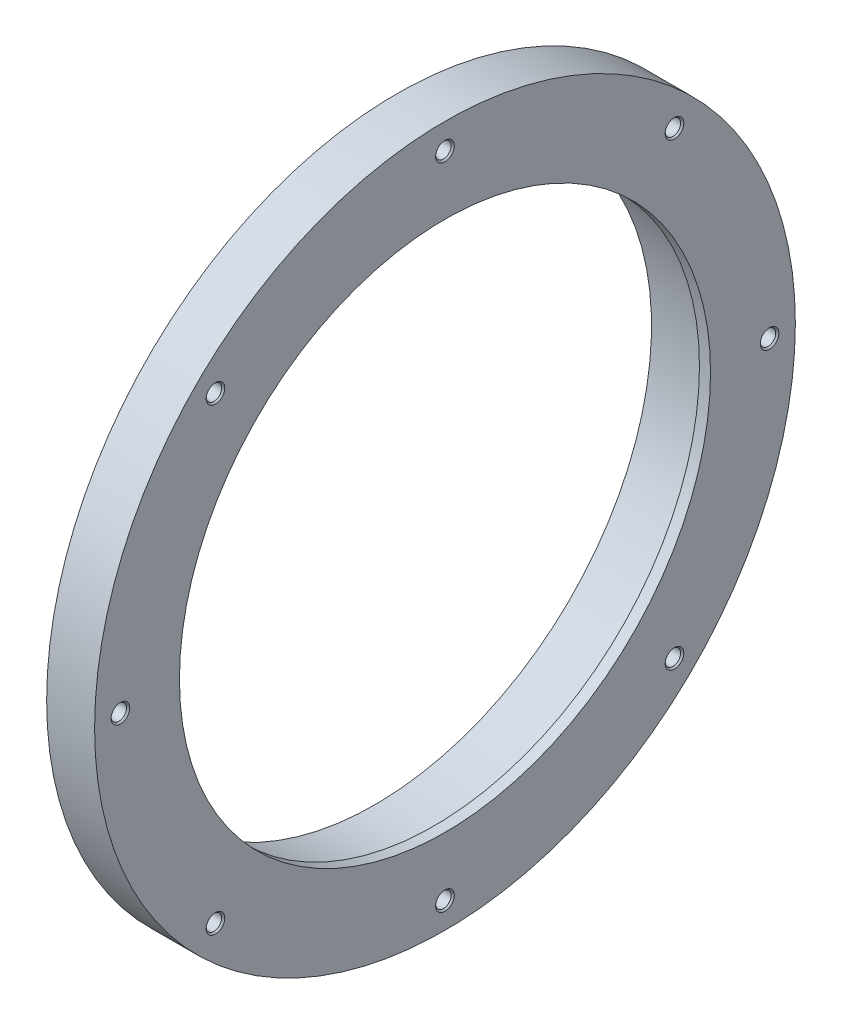
from build123d import *

# Parameters (mm, degrees)
OTW_R_GWINTOWANY_M51_D           = 4.2
OTW_R_GWINTOWANY_M51_CSINK_D     = 5.05
OTW_R_GWINTOWANY_M51_CSINK_ANGLE = 90


with BuildPart() as part:
    # Szkic1 → Obrót1 (revolve)
    with BuildSketch(Plane.XY):
        Polygon((18.999999909, 95.000000207), (5.999999909, 95.000000207), (5.999999909, 80), (-9.1e-08, 80), (-9.1e-08, 75.000000207), (15.999999909, 75.000000207), (15.999999909, 72), (18.999999909, 72), align=None)
    revolve(axis=Axis((0, 0, 0), (1, 0, 0)))

    # Otwór gwintowany M51 (through all)
    with Locations(Plane(origin=(18.999999909, 0, 0), x_dir=(0, 0, -1), z_dir=(1, 0, 0))):
        with Locations((0, 88), (62.225396744, 62.225396744), (88, 0), (62.225396744, -62.225396744), (0, -88), (-62.225396744, -62.225396744), (-88, 0), (-62.225396744, 62.225396744), (0, 0)):
            CounterSinkHole(OTW_R_GWINTOWANY_M51_D / 2, OTW_R_GWINTOWANY_M51_CSINK_D / 2, counter_sink_angle=OTW_R_GWINTOWANY_M51_CSINK_ANGLE)


solid = part.part
